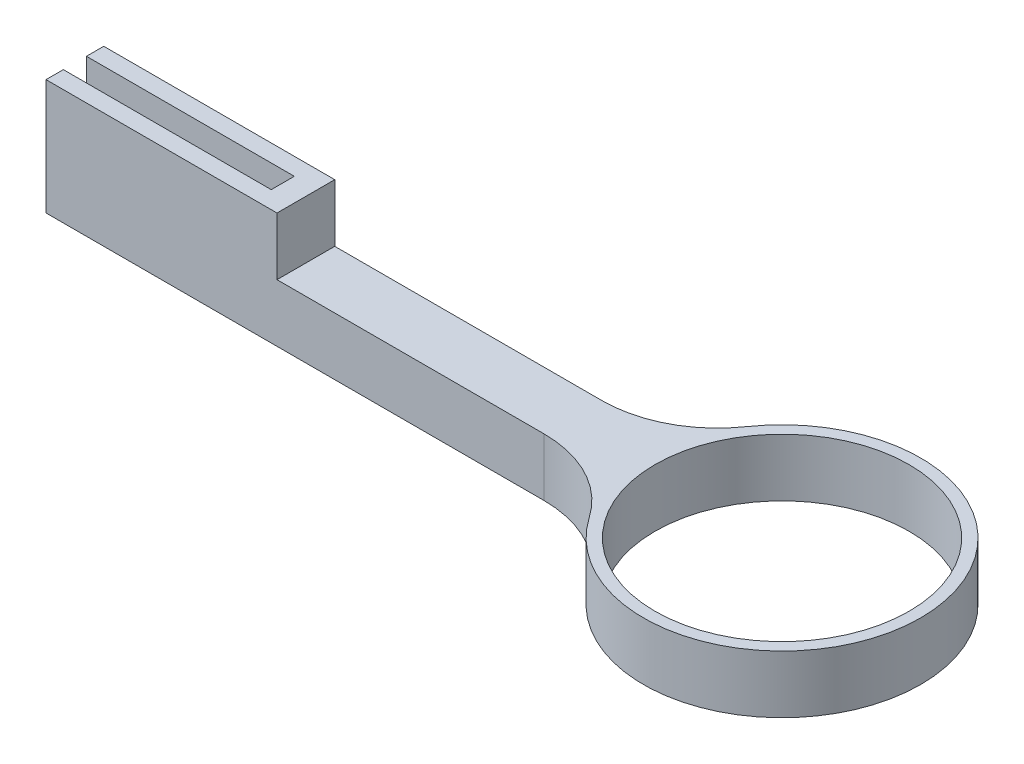
from build123d import *

# Parameters (mm, degrees)
SKETCH_1_R   = 12
SKETCH_1_R_2 = 11
RING_DEPTH   = 5
SKETCH_2_W   = 50
SKETCH_2_H   = 5
STICK_DEPTH  = 5
SKETCH_3_W   = 20
SKETCH_3_H   = 5
KEY_DEPTH    = 10
FILLET_1_R   = 10
SKETCH_5_W   = 2
SKETCH_5_H   = 5
SLOT_DEPTH   = 18


with BuildPart() as part:
    # Эскиз1 → ring (new body)
    with BuildSketch(Plane(origin=(0, 0, 0), x_dir=(1, 0, 0), z_dir=(0, 1, 0))):
        Circle(SKETCH_1_R)
        Circle(SKETCH_1_R_2, mode=Mode.SUBTRACT)
    extrude(amount=RING_DEPTH)

    # Эскиз2 → stick (add)
    with BuildSketch(Plane(origin=(0, 0, 0), x_dir=(1, 0, 0), z_dir=(0, 1, 0))):
        with Locations((-36.22497216, 0)):
            Rectangle(SKETCH_2_W, SKETCH_2_H)
    extrude(amount=STICK_DEPTH)

    # Эскиз3 → key (add)
    with BuildSketch(Plane(origin=(0, 0, 0), x_dir=(1, 0, 0), z_dir=(0, 1, 0))):
        with Locations((-51.22497216, 0)):
            Rectangle(SKETCH_3_W, SKETCH_3_H)
    extrude(amount=KEY_DEPTH)

    # Скругление1
    fillet_1_edges = [part.edges().sort_by_distance(p)[0] for p in [
        (-11.736694594, 2.5, 2.5),
        (-11.736694594, 2.5, -2.5),
    ]]
    fillet(fillet_1_edges, radius=FILLET_1_R)

    # Эскиз5 → slot (cut)
    with BuildSketch(Plane.ZY.offset(61.22497216)):
        with Locations((0, 7.5)):
            Rectangle(SKETCH_5_W, SKETCH_5_H)
    extrude(amount=-SLOT_DEPTH, mode=Mode.SUBTRACT)


solid = part.part
